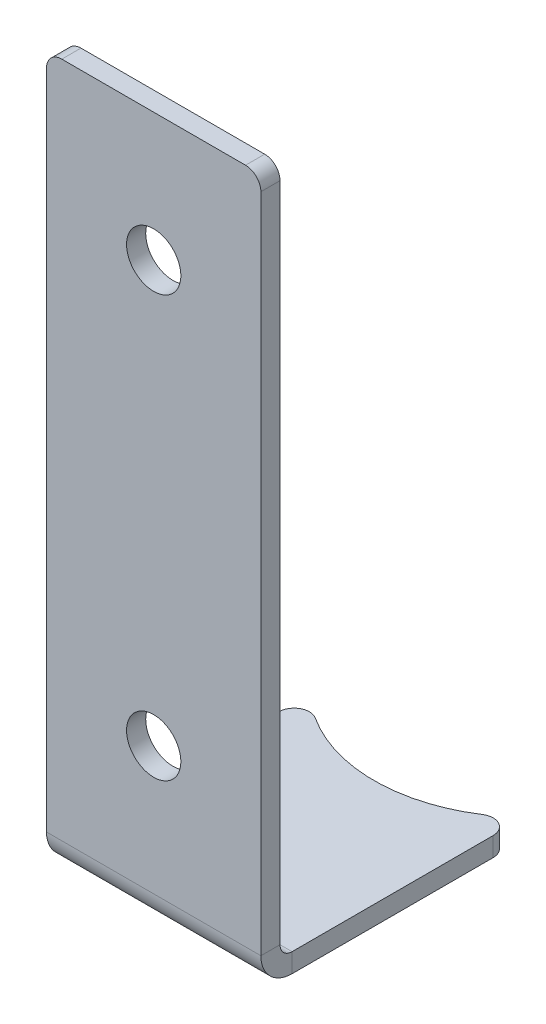
from build123d import *

# Parameters (mm, degrees)
BASE_FLANGE1_DEPTH   = 1.5875
EDGE_FLANGE1_DEPTH   = 17.78
M4_CLEARANCE_HOLE1_D = 4.5
FILLET1_R            = 1.27


# Sheet-metal steps are written as plain solids
with BuildPart() as part:
    # Sketch1 → Base-Flange1 (new body)
    with BuildSketch(Plane(origin=(0, 0, 0), x_dir=(1, 0, 0), z_dir=(0, 1, 0))):
        with BuildLine():
            Line((-8.89, -9.069614104), (-8.89, -28.119614104))
            Line((-8.89, -28.119614104), (8.89, -28.119614104))
            Line((8.89, -28.119614104), (8.89, -9.069614104))
            ThreePointArc((8.89, -9.069614104), (0, -12.7), (-8.89, -9.069614104))
        make_face()
    extrude(amount=-BASE_FLANGE1_DEPTH)

    # Edge-Flange1 section (across the edge) → Edge-Flange1 (add)
    with BuildSketch(Plane(origin=(-8.89, 0, 29.389614104), x_dir=(0, 0, -1), z_dir=(1, 0, 0))):
        with BuildLine():
            Line((-1.5875, 1), (-1.5875, 57.15))
            Line((-1.5875, 57.15), (0, 57.15))
            Line((0, 57.15), (0, 1))
            ThreePointArc((0, 1), (0.292893219, 0.292893219), (1, 0))
            Line((1, 0), (1.27, 0))
            Line((1.27, 0), (1.27, -1.5875))
            Line((1.27, -1.5875), (1, -1.5875))
            ThreePointArc((1, -1.5875), (-0.829638796, -0.829638796), (-1.5875, 1))
        make_face()
    extrude(amount=EDGE_FLANGE1_DEPTH)

    # M4 Clearance Hole1 (through all)
    with Locations(Plane(origin=(0, 0, 29.389614104), x_dir=(-1, 0, 0), z_dir=(0, 0, -1))):
        with Locations((0, 46.524999898), (0, 11.625)):
            Hole(M4_CLEARANCE_HOLE1_D / 2)

    # Fillet1
    fillet1_edges = [part.edges().sort_by_distance(p)[0] for p in [
        (-8.89, 57.15, 30.183364104),
        (8.89, 57.15, 30.183364104),
        (8.89, -0.79375, 9.069614104),
        (-8.89, -0.79375, 9.069614104),
    ]]
    fillet(fillet1_edges, radius=FILLET1_R)


solid = part.part
